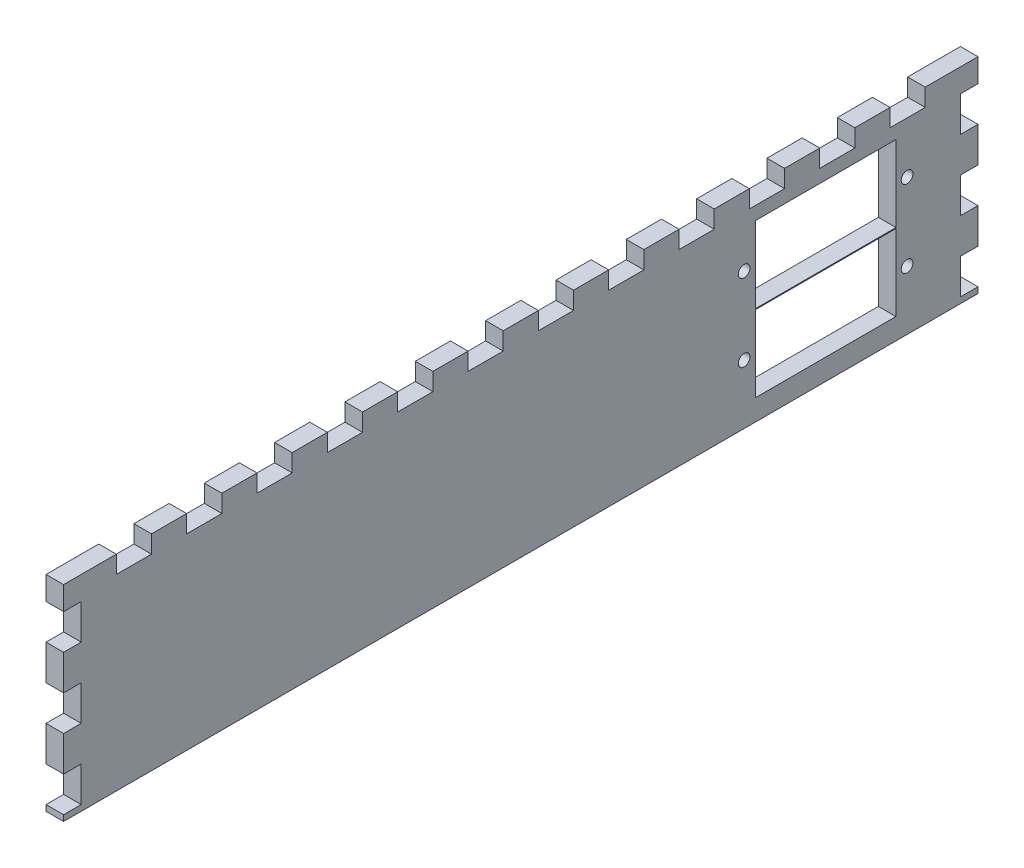
from build123d import *

# Parameters (mm, degrees)
SKETCH1_W               = 150
SKETCH1_H               = 32
BOSS_EXTRUDE1_DEPTH     = 3
SKETCH3_W               = 3
SKETCH3_H               = 6
BOSS_EXTRUDE2_DEPTH     = 3
LPATTERN1_COUNT         = 3
LPATTERN1_PITCH         = 12
LPATTERN1_COL_COUNT     = 2
LPATTERN1_COL_PITCH     = 12
SKETCH4_W               = 3
SKETCH4_H               = 6
BOSS_EXTRUDE3_DEPTH     = 3
LPATTERN2_COUNT         = 7
LPATTERN2_PITCH         = 12
LPATTERN2_COL_COUNT     = 7
LPATTERN2_COL_PITCH     = 12
SKETCH5_W               = 3
SKETCH5_H               = 2
SKETCH5_H_2             = 5
CUT_EXTRUDE1_DEPTH      = 3
MIRROR1_COPY_1_SKETCH_W = 3
MIRROR1_COPY_1_SKETCH_H = 6
MIRROR1_COPY_1_DEPTH    = 3
MIRROR1_COPY_2_SKETCH_W = 3
MIRROR1_COPY_2_SKETCH_H = 6
MIRROR1_COPY_2_DEPTH    = 3
MIRROR1_COPY_3_SKETCH_W = 3
MIRROR1_COPY_3_SKETCH_H = 6
MIRROR1_COPY_3_DEPTH    = 3
MIRROR1_COPY_4_SKETCH_W = 3
MIRROR1_COPY_4_SKETCH_H = 6
MIRROR1_COPY_4_DEPTH    = 3
SKETCH6_R               = 1
SKETCH6_W               = 24
SKETCH6_H               = 13
CUT_EXTRUDE2_DEPTH      = 81.336791074


with BuildPart() as part:
    # Sketch1 → Boss-Extrude1 (new body)
    with BuildSketch(Plane(origin=(0, 0, 0), x_dir=(0, 0, -1), z_dir=(1, 0, 0))):
        Rectangle(SKETCH1_W, SKETCH1_H)
    extrude(amount=BOSS_EXTRUDE1_DEPTH)

    # Sketch3 → Boss-Extrude2 (add)
    with BuildSketch(Plane(origin=(0, 0, -75), x_dir=(-1, 0, 0), z_dir=(0, 0, -1))):
        with Locations((-1.5, 6)):
            Rectangle(SKETCH3_W, SKETCH3_H)
    boss_extrude2 = extrude(amount=BOSS_EXTRUDE2_DEPTH)

    # LPattern1: Boss-Extrude2 ×3
    with Locations(*[(0, -i * LPATTERN1_PITCH, 0) for i in range(1, LPATTERN1_COUNT)]):
        add(boss_extrude2)

    # LPattern1 col: Boss-Extrude2 ×2
    with Locations(*[(0, i * LPATTERN1_COL_PITCH, 0) for i in range(1, LPATTERN1_COL_COUNT)]):
        add(boss_extrude2)

    # Sketch4 → Boss-Extrude3 (add)
    with BuildSketch(Plane(origin=(0, 16, 0), x_dir=(1, 0, 0), z_dir=(0, 1, 0))):
        with Locations((1.5, 0)):
            Rectangle(SKETCH4_W, SKETCH4_H)
    boss_extrude3 = extrude(amount=BOSS_EXTRUDE3_DEPTH)

    # LPattern2: Boss-Extrude3 ×7
    with Locations(*[(0, 0, -i * LPATTERN2_PITCH) for i in range(1, LPATTERN2_COUNT)]):
        add(boss_extrude3)

    # LPattern2 col: Boss-Extrude3 ×7
    with Locations(*[(0, 0, i * LPATTERN2_COL_PITCH) for i in range(1, LPATTERN2_COL_COUNT)]):
        add(boss_extrude3)

    # Sketch5 → Cut-Extrude1 (cut)
    with BuildSketch(Plane.ZY):
        with Locations((-76.5, 20)):
            Rectangle(SKETCH5_W, SKETCH5_H)
        with Locations((-76.5, -18.5)):
            Rectangle(SKETCH5_W, SKETCH5_H_2)
    cut_extrude1 = extrude(amount=-CUT_EXTRUDE1_DEPTH, mode=Mode.SUBTRACT)

    # Mirror1 copy 1 sketch → Mirror1 copy 1 (add)
    with BuildSketch(Plane(origin=(0, -12, 75), x_dir=(-1, 0, 0), z_dir=(0, 0, 1))):
        with Locations((-1.5, -6)):
            Rectangle(MIRROR1_COPY_1_SKETCH_W, MIRROR1_COPY_1_SKETCH_H)
    extrude(amount=MIRROR1_COPY_1_DEPTH)

    # Mirror1 copy 2 sketch → Mirror1 copy 2 (add)
    with BuildSketch(Plane(origin=(0, -24, 75), x_dir=(-1, 0, 0), z_dir=(0, 0, 1))):
        with Locations((-1.5, -6)):
            Rectangle(MIRROR1_COPY_2_SKETCH_W, MIRROR1_COPY_2_SKETCH_H)
    extrude(amount=MIRROR1_COPY_2_DEPTH)

    # Mirror1 copy 3 sketch → Mirror1 copy 3 (add)
    with BuildSketch(Plane(origin=(0, 12, 75), x_dir=(-1, 0, 0), z_dir=(0, 0, 1))):
        with Locations((-1.5, -6)):
            Rectangle(MIRROR1_COPY_3_SKETCH_W, MIRROR1_COPY_3_SKETCH_H)
    extrude(amount=MIRROR1_COPY_3_DEPTH)

    # Mirror1 copy 4 sketch → Mirror1 copy 4 (add)
    with BuildSketch(Plane(origin=(0, 0, 75), x_dir=(-1, 0, 0), z_dir=(0, 0, 1))):
        with Locations((-1.5, -6)):
            Rectangle(MIRROR1_COPY_4_SKETCH_W, MIRROR1_COPY_4_SKETCH_H)
    extrude(amount=MIRROR1_COPY_4_DEPTH)

    # Mirror2: Cut-Extrude1 across plane
    add(cut_extrude1.mirror(Plane.XY), mode=Mode.SUBTRACT)

    # Sketch6 → Cut-Extrude2 (cut, through all)
    with BuildSketch(Plane(origin=(3, 0, 0), x_dir=(0, 0, -1), z_dir=(1, 0, 0))):
        with Locations((38.1, -5.898339945)):
            Circle(SKETCH6_R)
        with Locations((65.9, -5.898339945)):
            Circle(SKETCH6_R)
        with Locations((38.1, 7.257908581)):
            Circle(SKETCH6_R)
        with Locations((65.9, 7.257908581)):
            Circle(SKETCH6_R)
        with Locations((52, -5.898339945)):
            Rectangle(SKETCH6_W, SKETCH6_H)
        with Locations((52, 7.257908581)):
            Rectangle(SKETCH6_W, SKETCH6_H)
    extrude(amount=-CUT_EXTRUDE2_DEPTH, mode=Mode.SUBTRACT)


solid = part.part
